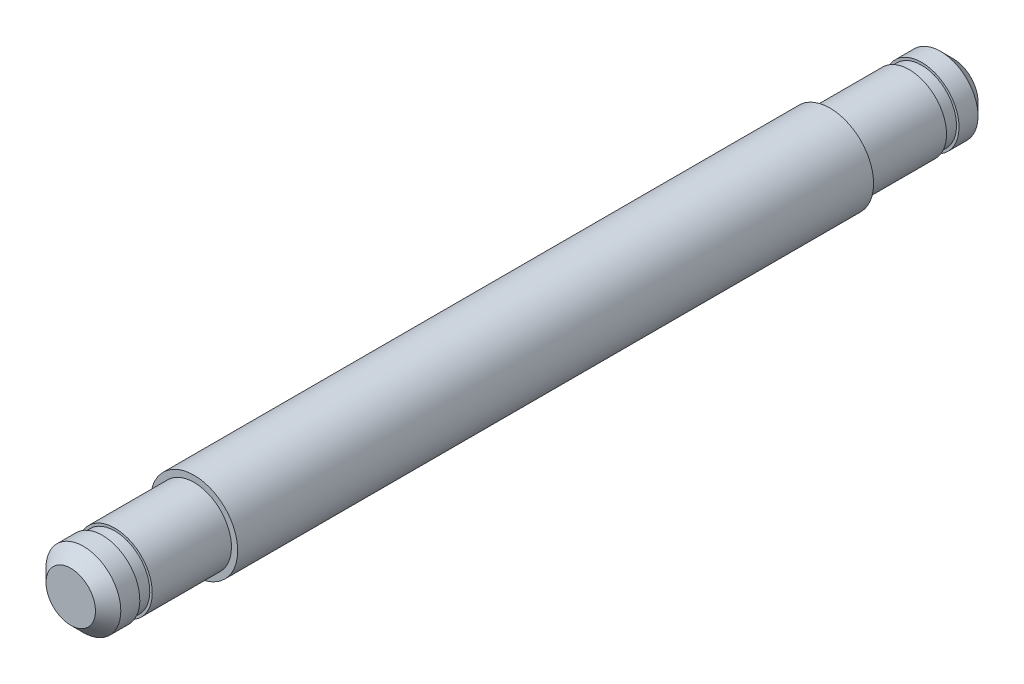
from build123d import *

# Parameters (mm, degrees)
CHAMFER1_SIZE = 0.508


with BuildPart() as part:
    # Sketch1 → Revolve2 (revolve)
    with BuildSketch(Plane(origin=(0, 0, 0), x_dir=(0, 0, -1), z_dir=(1, 0, 0))):
        Polygon((-17.6958, 0), (-17.6958, 1.5), (-16.4258, 1.5), (-16.4258, 1.4), (-15.9258, 1.4), (-15.9258, 1.5), (-12.7508, 1.5), (-12.7508, 1.75), (0, 1.75), (0, 0), align=None)
    revolve2 = revolve(axis=Axis((0, 0, 0.682962963), (0, 0, 1)))

    # Mirror1: Revolve2 across plane
    add(revolve2.mirror(Plane.XY))

    # Chamfer1
    chamfer1_edges = [part.edges().sort_by_distance(p)[0] for p in [
        (0, -1.5, 17.6958),
        (0, -1.5, -17.6958),
    ]]
    chamfer(chamfer1_edges, length=CHAMFER1_SIZE)


solid = part.part
